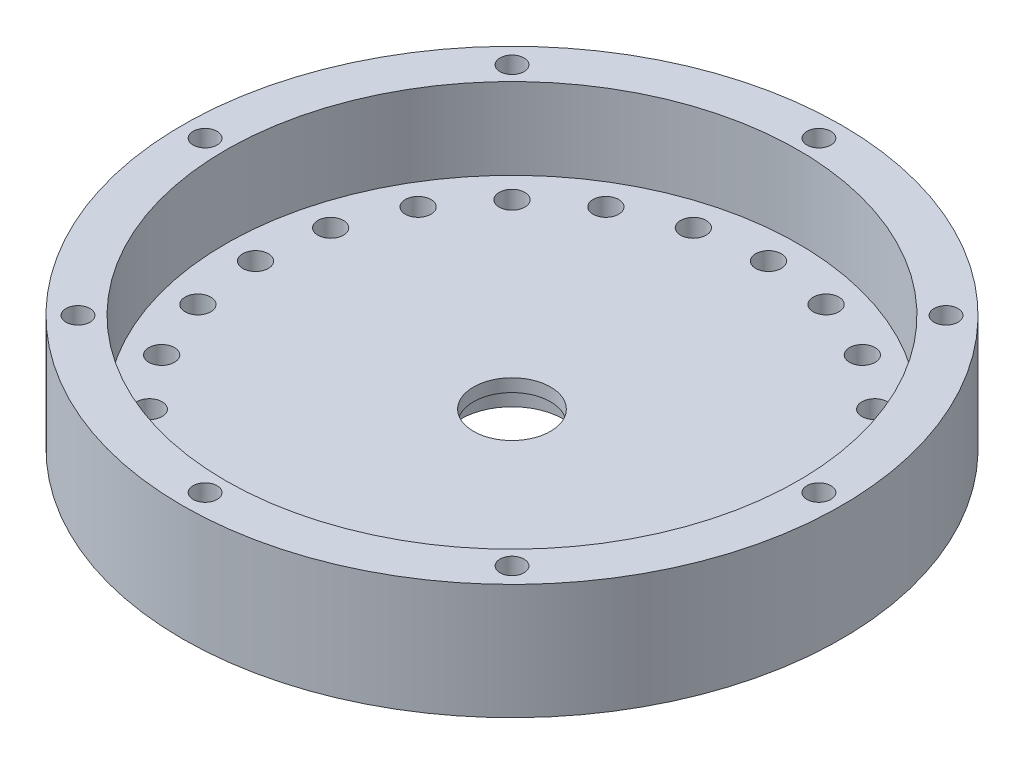
from build123d import *

# Parameters (mm, degrees)
SKETCH1_R           = 77.1
BOSS_EXTRUDE1_DEPTH = 27
SKETCH2_R           = 67
CUT_EXTRUDE1_DEPTH  = 19
SKETCH3_R           = 3
CUT_EXTRUDE2_DEPTH  = 5
SKETCH4_R           = 12
CUT_EXTRUDE3_DEPTH  = 5
SKETCH5_R           = 9
CUT_EXTRUDE4_DEPTH  = 5
SKETCH6_R           = 2.8
CUT_EXTRUDE5_DEPTH  = 8


with BuildPart() as part:
    # Sketch1 → Boss-Extrude1 (new body)
    with BuildSketch(Plane(origin=(0, 0, 0), x_dir=(1, 0, 0), z_dir=(0, 1, 0))):
        Circle(SKETCH1_R)
    extrude(amount=BOSS_EXTRUDE1_DEPTH)

    # Sketch2 → Cut-Extrude1 (cut)
    with BuildSketch(Plane(origin=(0, 27, 0), x_dir=(1, 0, 0), z_dir=(0, 1, 0))):
        Circle(SKETCH2_R)
    extrude(amount=-CUT_EXTRUDE1_DEPTH, mode=Mode.SUBTRACT)

    # Sketch3 → Cut-Extrude2 (cut)
    with BuildSketch(Plane(origin=(0, 8, 0), x_dir=(1, 0, 0), z_dir=(0, 1, 0))):
        with Locations((60, 0)):
            Circle(SKETCH3_R)
        with Locations((57.955549577, -15.529142706)):
            Circle(SKETCH3_R)
        with Locations((51.961524227, -30)):
            Circle(SKETCH3_R)
        with Locations((42.426406871, -42.426406871)):
            Circle(SKETCH3_R)
        with Locations((30, -51.961524227)):
            Circle(SKETCH3_R)
        with Locations((15.529142706, -57.955549577)):
            Circle(SKETCH3_R)
        with Locations((0, -60)):
            Circle(SKETCH3_R)
        with Locations((-15.529142706, -57.955549577)):
            Circle(SKETCH3_R)
        with Locations((-30, -51.961524227)):
            Circle(SKETCH3_R)
        with Locations((-42.426406871, -42.426406871)):
            Circle(SKETCH3_R)
        with Locations((-51.961524227, -30)):
            Circle(SKETCH3_R)
        with Locations((-57.955549577, -15.529142706)):
            Circle(SKETCH3_R)
        with Locations((-60, 0)):
            Circle(SKETCH3_R)
        with Locations((-57.955549577, 15.529142706)):
            Circle(SKETCH3_R)
        with Locations((-51.961524227, 30)):
            Circle(SKETCH3_R)
        with Locations((-42.426406871, 42.426406871)):
            Circle(SKETCH3_R)
        with Locations((-30, 51.961524227)):
            Circle(SKETCH3_R)
        with Locations((-15.529142706, 57.955549577)):
            Circle(SKETCH3_R)
        with Locations((0, 60)):
            Circle(SKETCH3_R)
        with Locations((15.529142706, 57.955549577)):
            Circle(SKETCH3_R)
        with Locations((30, 51.961524227)):
            Circle(SKETCH3_R)
        with Locations((42.426406871, 42.426406871)):
            Circle(SKETCH3_R)
        with Locations((51.961524227, 30)):
            Circle(SKETCH3_R)
        with Locations((57.955549577, 15.529142706)):
            Circle(SKETCH3_R)
    extrude(amount=-CUT_EXTRUDE2_DEPTH, mode=Mode.SUBTRACT)

    # Sketch4 → Cut-Extrude3 (cut)
    with BuildSketch(Plane.XZ):
        Circle(SKETCH4_R)
    extrude(amount=-CUT_EXTRUDE3_DEPTH, mode=Mode.SUBTRACT)

    # Sketch5 → Cut-Extrude4 (cut)
    with BuildSketch(Plane(origin=(0, 8, 0), x_dir=(1, 0, 0), z_dir=(0, 1, 0))):
        Circle(SKETCH5_R)
    extrude(amount=-CUT_EXTRUDE4_DEPTH, mode=Mode.SUBTRACT)

    # Sketch6 → Cut-Extrude5 (cut)
    with BuildSketch(Plane(origin=(0, 27, 0), x_dir=(1, 0, 0), z_dir=(0, 1, 0))):
        with Locations((0, 71.8)):
            Circle(SKETCH6_R)
        with Locations((50.770266889, 50.770266889)):
            Circle(SKETCH6_R)
        with Locations((71.8, 0)):
            Circle(SKETCH6_R)
        with Locations((50.770266889, -50.770266889)):
            Circle(SKETCH6_R)
        with Locations((0, -71.8)):
            Circle(SKETCH6_R)
        with Locations((-50.770266889, -50.770266889)):
            Circle(SKETCH6_R)
        with Locations((-71.8, 0)):
            Circle(SKETCH6_R)
        with Locations((-50.770266889, 50.770266889)):
            Circle(SKETCH6_R)
    extrude(amount=-CUT_EXTRUDE5_DEPTH, mode=Mode.SUBTRACT)


solid = part.part
